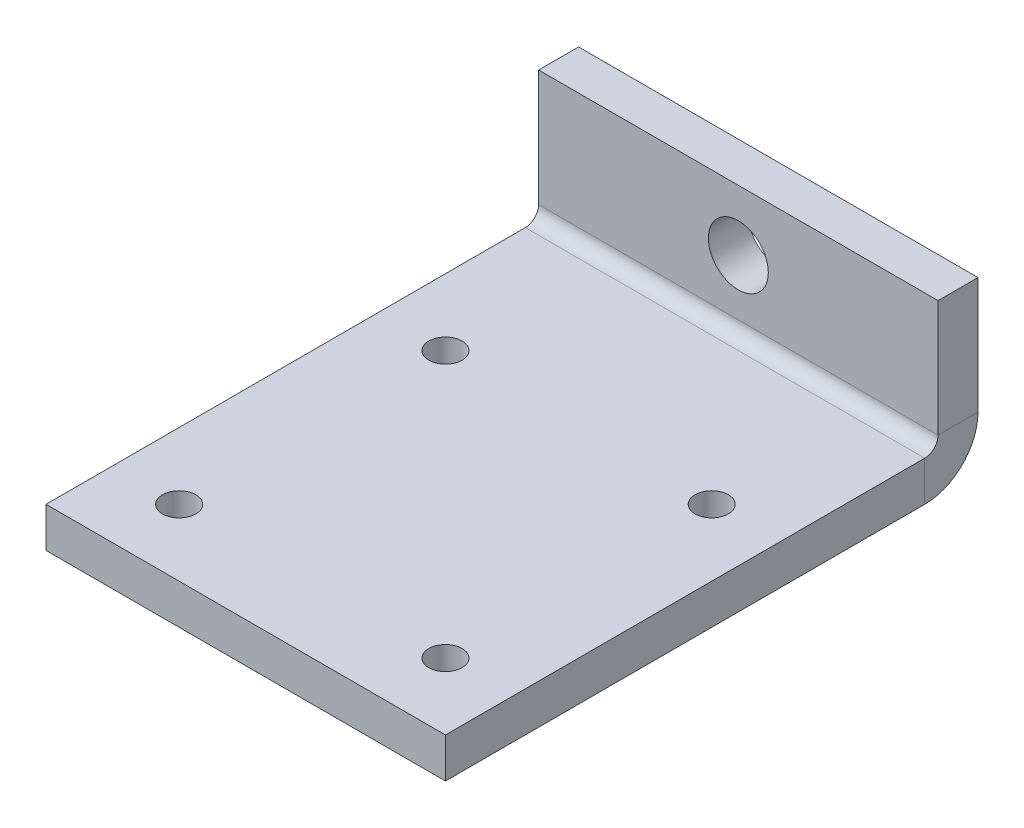
from build123d import *

# Parameters (mm, degrees)
T_LE_DE_BASE_PLI_E1_DEPTH = 30
TROU_TARAUD_M31_D         = 2.5
D_GAGEMENT_M41_D          = 4.5


# Sheet-metal steps are written as plain solids
with BuildPart() as part:
    # Esquisse1 → Tôle de base pliée1 (new body)
    with BuildSketch(Plane(origin=(0, 0, 0), x_dir=(0, 0, -1), z_dir=(1, 0, 0))):
        with BuildLine():
            Line((0, 12.75), (0, 4))
            ThreePointArc((0, 4), (-1.171572875, 1.171572875), (-4, 0))
            Line((-4, 0), (-40, 0))
            Line((-40, 0), (-40, 3))
            Line((-40, 3), (-4, 3))
            ThreePointArc((-4, 3), (-3.292893219, 3.292893219), (-3, 4))
            Line((-3, 4), (-3, 12.75))
            Line((-3, 12.75), (0, 12.75))
        make_face()
    extrude(amount=T_LE_DE_BASE_PLI_E1_DEPTH)

    # Trou taraudé M31 (through all)
    with Locations(Plane(origin=(0, 3, 0), x_dir=(1, 0, 0), z_dir=(0, 1, 0))):
        with Locations((5, -35), (5, -15), (25, -15), (25, -35)):
            Hole(TROU_TARAUD_M31_D / 2)

    # Dégagement M41 (through all)
    with Locations(Plane.XY.offset(3)):
        with Locations((15, 8.2)):
            Hole(D_GAGEMENT_M41_D / 2)


solid = part.part
